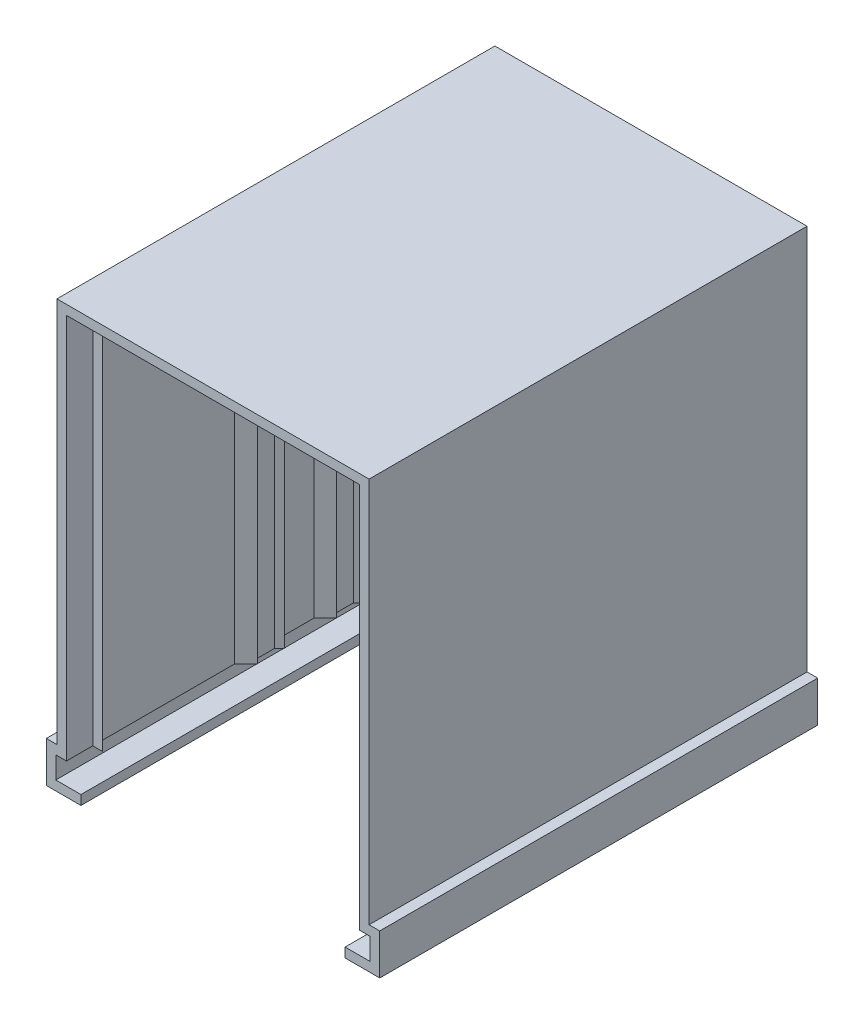
from build123d import *

# Parameters (mm, degrees)
BOSS_EXTRUDE1_DEPTH = 44.25
BOSS_EXTRUDE2_DEPTH = 39
BOSS_EXTRUDE3_DEPTH = 39
LPATTERN1_START     = 0.1
LPATTERN1_DEPTH     = 39
SPLIT1_START        = 0.1
SPLIT1_DEPTH        = 39
SPLIT1_2_DEPTH      = 39
SPLIT1_3_DEPTH      = 39


# Read off the part's stored shape, not the designer's step: LPattern1, Split1
with BuildPart() as part:
    # Sketch1 → Boss-Extrude1 (new body)
    with BuildSketch(Plane.XY):
        Polygon((-14.81, 0.1), (-15.885, 0.1), (-15.885, -2.1), (-13.345, -2.1), (-13.345, -3.06), (-16.845, -3.06), (-16.845, 1.06), (-15.77, 1.06), (-15.77, 40.06), (0, 40.06), (15.77, 40.06), (15.77, 1.06), (16.845, 1.06), (16.845, -3.06), (13.345, -3.06), (13.345, -2.1), (15.885, -2.1), (15.885, 0.1), (14.81, 0.1), (14.81, 39.1), (0, 39.1), (-14.81, 39.1), align=None)
    extrude(amount=-BOSS_EXTRUDE1_DEPTH)

    # Sketch2 → Boss-Extrude2 (add)
    with BuildSketch(Plane.XZ.offset(-39.1)):
        Polygon((-14.81, -2.66), (-13.81, -2.66), (-14.81, -3.66), align=None)
        Polygon((14.81, -3.66), (14.81, -2.66), (13.81, -2.66), align=None)
    extrude(amount=BOSS_EXTRUDE2_DEPTH)

    # Sketch3 → Boss-Extrude3 (add)
    with BuildSketch(Plane.XZ.offset(-39.1)):
        Polygon((-14.81, -32.99), (-14.81, -38.01), (-13.65, -36.85), (-14.15, -36.35), (-14.15, -34.65), (-13.65, -34.15), align=None)
        Polygon((14.15, -36.35), (13.65, -36.85), (14.81, -38.01), (14.81, -32.99), (13.65, -34.15), (14.15, -34.65), align=None)
    extrude(amount=BOSS_EXTRUDE3_DEPTH)

    # LPattern1 outline → LPattern1 (add)
    with BuildSketch(Plane(origin=(0, 0, 0), x_dir=(1, 0, 0), z_dir=(0, 1, 0)).offset(LPATTERN1_START)):
        Polygon((-13.65, 20.85), (-14.81, 22.01), (-14.81, 16.99), (-13.65, 18.15), (-14.15, 18.65), (-14.15, 20.35), align=None)
        Polygon((-14.15, 26.65), (-14.15, 28.35), (-13.65, 28.85), (-14.81, 30.01), (-14.81, 24.99), (-13.65, 26.15), align=None)
        Polygon((-14.15, 41.65), (-14.15, 43.35), (-13.65, 43.85), (-14.81, 45.01), (-14.81, 39.99), (-13.65, 41.15), align=None)
        Polygon((14.81, 16.99), (14.81, 22.01), (13.65, 20.85), (14.15, 20.35), (14.15, 18.65), (13.65, 18.15), align=None)
        Polygon((14.15, 28.35), (14.15, 26.65), (13.65, 26.15), (14.81, 24.99), (14.81, 30.01), (13.65, 28.85), align=None)
        Polygon((14.15, 43.35), (14.15, 41.65), (13.65, 41.15), (14.81, 39.99), (14.81, 45.01), (13.65, 43.85), align=None)
    extrude(amount=LPATTERN1_DEPTH)

    # Split1 outline → Split1 (cut)
    with BuildSketch(Plane(origin=(0, 0, 0), x_dir=(1, 0, 0), z_dir=(0, 1, 0)).offset(SPLIT1_START)):
        Polygon((14.81, 45.01), (14.05, 44.25), (14.81, 44.25), align=None)
        Polygon((-14.05, 44.25), (-14.81, 45.01), (-14.81, 44.25), align=None)
    extrude(amount=SPLIT1_DEPTH, mode=Mode.SUBTRACT)


with BuildPart() as body_2:
    # Split1 2 outline → Split1 2 (new body)
    with BuildSketch(Plane(origin=(0, 0, 0), x_dir=(1, 0, 0), z_dir=(0, 1, 0)).offset(SPLIT1_START)):
        Polygon((-14.81, 44.25), (-14.05, 44.25), (-14.81, 45.01), align=None)
    extrude(amount=SPLIT1_2_DEPTH)


with BuildPart() as body_3:
    # Split1 3 outline → Split1 3 (new body)
    with BuildSketch(Plane(origin=(0, 0, 0), x_dir=(1, 0, 0), z_dir=(0, 1, 0)).offset(SPLIT1_START)):
        Polygon((14.05, 44.25), (14.81, 44.25), (14.81, 45.01), align=None)
    extrude(amount=SPLIT1_3_DEPTH)


solid = part.part
